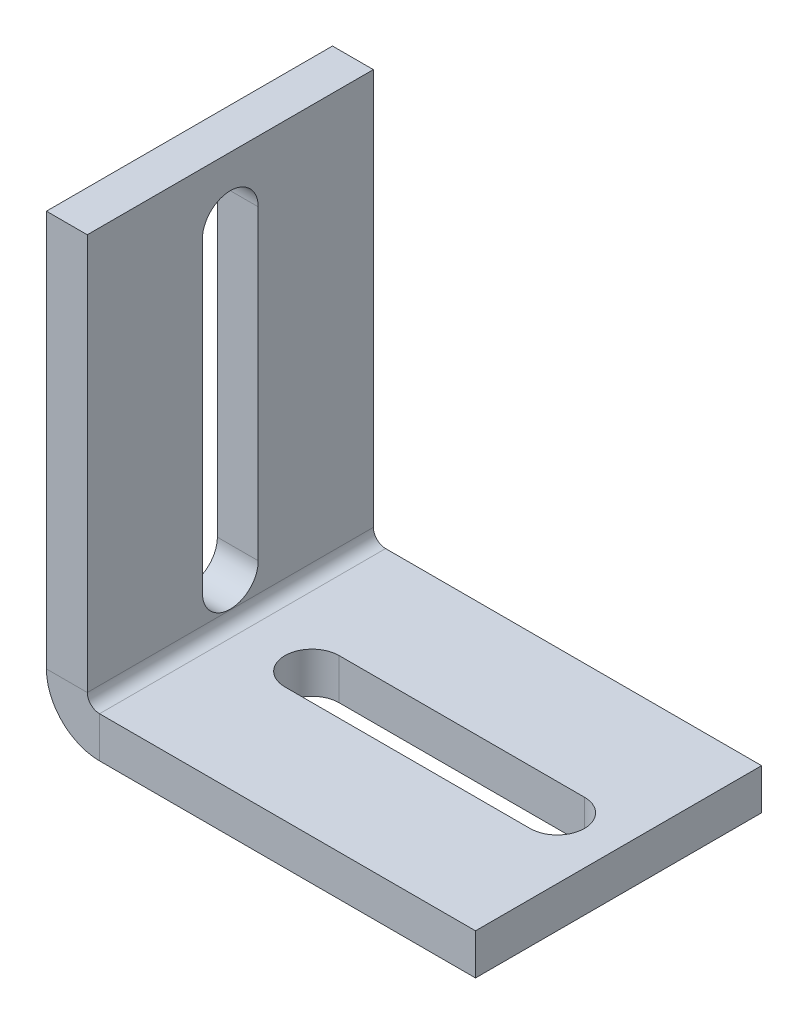
from build123d import *

# Parameters (mm, degrees)
CROQUIS1_W                    = 70
CROQUIS1_H                    = 110
SALIENTE_EXTRUIR1_DEPTH       = 7.9375
CROQUIS2_W                    = 97.0625
CROQUIS2_H                    = 70
SALIENTE_EXTRUIR2_DEPTH       = 7.9375
CONVERTIR_S_LIDO1_START       = -22.0625
CONVERTIR_S_LIDO1_OUTLINE_W   = 97.0625
CONVERTIR_S_LIDO1_OUTLINE_H   = 70
CONVERTIR_S_LIDO1_DEPTH       = 5.0625
CONVERTIR_S_LIDO1_START_2     = -18.37306
CONVERTIR_S_LIDO1_2_OUTLINE_W = 2.0625
CONVERTIR_S_LIDO1_2_OUTLINE_H = 28.16517088
CONVERTIR_S_LIDO1_2_DEPTH     = 98.37306
CONVERTIR_S_LIDO1_START_3     = 65
CONVERTIR_S_LIDO1_3_OUTLINE_W = 2.0625
CONVERTIR_S_LIDO1_3_OUTLINE_H = 13.66965824
CONVERTIR_S_LIDO1_3_DEPTH     = 15
CONVERTIR_S_LIDO1_4_OUTLINE_W = 2.0625
CONVERTIR_S_LIDO1_4_OUTLINE_H = 13.66965824
CONVERTIR_S_LIDO1_4_DEPTH     = 8.37306
CONVERTIR_S_LIDO1_START_4     = 13
CONVERTIR_S_LIDO1_5_OUTLINE_W = 3
CONVERTIR_S_LIDO1_5_OUTLINE_H = 70
CONVERTIR_S_LIDO1_5_DEPTH     = 92
CONVERTIR_S_LIDO1_START_5     = 7.9375
CONVERTIR_S_LIDO1_6_DEPTH     = 2.0625
CONVERTIR_S_LIDO1_START_6     = -35
CONVERTIR_S_LIDO1_7_DEPTH     = 70


with BuildPart() as part:
    # Croquis1 → Saliente-Extruir1 (new body)
    with BuildSketch(Plane(origin=(0, 0, 0), x_dir=(0, 0, -1), z_dir=(1, 0, 0))):
        with Locations((0, 25)):
            Rectangle(CROQUIS1_W, CROQUIS1_H)
        with BuildLine():
            Line((6.83482912, 65), (6.83482912, -10))
            ThreePointArc((6.83482912, -10), (0, -16.83482912), (-6.83482912, -10))
            Line((-6.83482912, -10), (-6.83482912, 65))
            ThreePointArc((-6.83482912, 65), (0, 71.83482912), (6.83482912, 65))
        make_face(mode=Mode.SUBTRACT)
    extrude(amount=SALIENTE_EXTRUIR1_DEPTH)

    # Croquis2 → Saliente-Extruir2 (add)
    with BuildSketch(Plane.XZ.offset(30)):
        with Locations((56.46875, 0)):
            Rectangle(CROQUIS2_W, CROQUIS2_H)
        with BuildLine():
            ThreePointArc((30, -6.640349162), (23.359650838, 0), (30, 6.640349162))
            Line((30, 6.640349162), (90, 6.640349162))
            ThreePointArc((90, 6.640349162), (96.640349162, 0), (90, -6.640349162))
            Line((90, -6.640349162), (30, -6.640349162))
        make_face(mode=Mode.SUBTRACT)
    extrude(amount=-SALIENTE_EXTRUIR2_DEPTH)

    # Convertir-Sólido1: read off the stored shape, not the designer's step
    # Convertir-Sólido1 outline → Convertir-Sólido1 (add)
    with BuildSketch(Plane(origin=(0, 0, 0), x_dir=(1, 0, 0), z_dir=(0, 1, 0)).offset(CONVERTIR_S_LIDO1_START)):
        with Locations((56.46875, 0)):
            Rectangle(CONVERTIR_S_LIDO1_OUTLINE_W, CONVERTIR_S_LIDO1_OUTLINE_H)
        with BuildLine():
            Line((90, -6.640349162), (30, -6.640349162))
            ThreePointArc((30, -6.640349162), (23.359650838, 0), (30, 6.640349162))
            Line((30, 6.640349162), (90, 6.640349162))
            ThreePointArc((90, 6.640349162), (96.640349162, 0), (90, -6.640349162))
        make_face(mode=Mode.SUBTRACT)
    extrude(amount=CONVERTIR_S_LIDO1_DEPTH)

    # Convertir-S_lido1 2 outline → Convertir-S_lido1 2 (add)
    with BuildSketch(Plane(origin=(0, 0, 0), x_dir=(1, 0, 0), z_dir=(0, 1, 0)).offset(CONVERTIR_S_LIDO1_START_2)):
        with Locations((8.96875, 20.91741456)):
            Rectangle(CONVERTIR_S_LIDO1_2_OUTLINE_W, CONVERTIR_S_LIDO1_2_OUTLINE_H)
        with Locations((8.96875, -20.91741456)):
            Rectangle(CONVERTIR_S_LIDO1_2_OUTLINE_W, CONVERTIR_S_LIDO1_2_OUTLINE_H)
    extrude(amount=CONVERTIR_S_LIDO1_2_DEPTH)

    # Convertir-S_lido1 3 outline → Convertir-S_lido1 3 (add)
    with BuildSketch(Plane(origin=(0, 0, 0), x_dir=(1, 0, 0), z_dir=(0, 1, 0)).offset(CONVERTIR_S_LIDO1_START_3)):
        with Locations((8.96875, 0)):
            Rectangle(CONVERTIR_S_LIDO1_3_OUTLINE_W, CONVERTIR_S_LIDO1_3_OUTLINE_H)
    extrude(amount=CONVERTIR_S_LIDO1_3_DEPTH)

    # Convertir-S_lido1 4 outline → Convertir-S_lido1 4 (add)
    with BuildSketch(Plane(origin=(0, 0, 0), x_dir=(1, 0, 0), z_dir=(0, 1, 0)).offset(CONVERTIR_S_LIDO1_START_2)):
        with Locations((8.96875, 0)):
            Rectangle(CONVERTIR_S_LIDO1_4_OUTLINE_W, CONVERTIR_S_LIDO1_4_OUTLINE_H)
    extrude(amount=CONVERTIR_S_LIDO1_4_DEPTH)

    # Convertir-S_lido1 5 outline → Convertir-S_lido1 5 (cut)
    with BuildSketch(Plane.YZ.offset(CONVERTIR_S_LIDO1_START_4)):
        with Locations((-18.5, 0)):
            Rectangle(CONVERTIR_S_LIDO1_5_OUTLINE_W, CONVERTIR_S_LIDO1_5_OUTLINE_H)
    extrude(amount=CONVERTIR_S_LIDO1_5_DEPTH, mode=Mode.SUBTRACT)

    # Convertir-S_lido1 6 outline → Convertir-S_lido1 6 (cut)
    with BuildSketch(Plane.YZ.offset(CONVERTIR_S_LIDO1_START_5)):
        with BuildLine():
            Line((65, 6.83482912), (65, -6.83482912))
            ThreePointArc((65, -6.83482912), (71.83482912, 0), (65, 6.83482912))
        make_face()
        with BuildLine():
            Line((-10, -6.83482912), (-10, 6.83482912))
            ThreePointArc((-10, 6.83482912), (-16.83482912, 0), (-10, -6.83482912))
        make_face()
    extrude(amount=CONVERTIR_S_LIDO1_6_DEPTH, mode=Mode.SUBTRACT)

    # Convertir-S_lido1 7 outline → Convertir-S_lido1 7 (cut)
    with BuildSketch(Plane.XY.offset(CONVERTIR_S_LIDO1_START_6)):
        with BuildLine():
            Line((0, -30), (13, -30))
            ThreePointArc((13, -30), (3.807611845, -26.192388155), (0, -17))
            Line((0, -17), (0, -30))
        make_face()
        with BuildLine():
            ThreePointArc((10, -17), (10.878679656, -19.121320344), (13, -20))
            Line((13, -20), (13, -17))
            Line((13, -17), (10, -17))
        make_face()
    extrude(amount=CONVERTIR_S_LIDO1_7_DEPTH, mode=Mode.SUBTRACT)


solid = part.part
